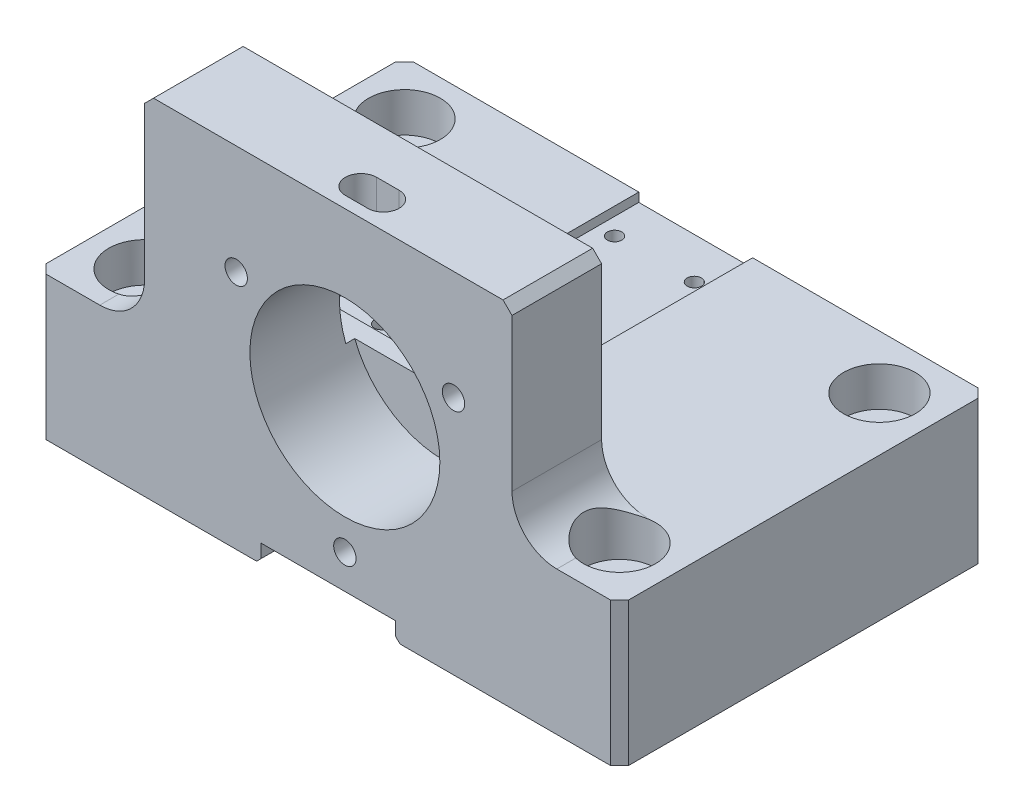
from build123d import *

# Parameters (mm, degrees)
SKETCH1_W                                           = 65
SKETCH1_H                                           = 41
BOSS_EXTRUDE1_DEPTH                                 = 16
SKETCH15_W                                          = 41
SKETCH15_H                                          = 10
BOSS_EXTRUDE4_DEPTH                                 = 23
SKETCH4_R                                           = 10.6
CUT_EXTRUDE3_DEPTH                                  = 11
M3_TAPPED_HOLE1_D                                   = 2.5
M3_TAPPED_HOLE1_DEPTH                               = 8.5
M3_TAPPED_HOLE1_TIP                                 = 0.751075774
CUT_EXTRUDE4_START                                  = -1
CUT_EXTRUDE4_DEPTH                                  = 1
SKETCH34_W                                          = 12.7
SKETCH34_H                                          = 2.6
CUT_EXTRUDE9_DEPTH                                  = 58.20576894
CUT_EXTRUDE7_DEPTH                                  = 1
M2_TAPPED_HOLE1_D                                   = 1.6
M2_TAPPED_HOLE1_DEPTH                               = 6
M2_TAPPED_HOLE1_TIP                                 = 0.480688495
CBORE_FOR_M4_HEX_SOCKET_HEAD_CAP_SCREW1_D           = 4.3
CBORE_FOR_M4_HEX_SOCKET_HEAD_CAP_SCREW1_CBORE_D     = 8
CBORE_FOR_M4_HEX_SOCKET_HEAD_CAP_SCREW1_CBORE_DEPTH = 4.4
FILLET1_R                                           = 5
CHAMFER4_SIZE                                       = 1
F_3_5_START                                         = 44
F_3_5_3_5_DIAMETER_SLOT1_DEPTH                      = 10
SKETCH33_W                                          = 15
SKETCH33_H                                          = 41
CUT_EXTRUDE8_DEPTH                                  = 2
CHAMFER5_SIZE                                       = 0.5


with BuildPart() as part:
    # Sketch1 → Boss-Extrude1 (new body)
    with BuildSketch(Plane(origin=(0, 15, 0), x_dir=(1, 0, 0), z_dir=(0, 1, 0))):
        with Locations((0, 20)):
            Rectangle(SKETCH1_W, SKETCH1_H)
    extrude(amount=BOSS_EXTRUDE1_DEPTH)

    # Sketch15 → Boss-Extrude4 (add)
    with BuildSketch(Plane(origin=(0, 31, 0), x_dir=(1, 0, 0), z_dir=(0, 1, 0))):
        with Locations((0, 4.5)):
            Rectangle(SKETCH15_W, SKETCH15_H)
    extrude(amount=BOSS_EXTRUDE4_DEPTH)

    # Sketch4 → Cut-Extrude3 (cut)
    with BuildSketch(Plane.XY.offset(0.5)):
        with Locations((1.85, 34.8)):
            Circle(SKETCH4_R)
    extrude(amount=-CUT_EXTRUDE3_DEPTH, mode=Mode.SUBTRACT)

    # M3 Tapped Hole1
    with Locations(Plane.XY.offset(0.5)):
        with Locations((13.974355653, 41.8), (1.85, 20.8), (-10.274355653, 41.8)):
            Hole(M3_TAPPED_HOLE1_D / 2, depth=M3_TAPPED_HOLE1_DEPTH)
            with Locations((0, 0, -(M3_TAPPED_HOLE1_DEPTH + M3_TAPPED_HOLE1_TIP / 2))):  # 118° drill point
                Cone(0, M3_TAPPED_HOLE1_D / 2, M3_TAPPED_HOLE1_TIP, mode=Mode.SUBTRACT)

    # Sketch16 → Cut-Extrude4 (cut)
    with BuildSketch(Plane(origin=(0, 31, 0), x_dir=(1, 0, 0), z_dir=(0, 1, 0)).offset(CUT_EXTRUDE4_START)):
        Polygon((-10.95, 12.5), (10.95, 12.5), (10.95, 16.3), (6.35, 16.3), (6.35, 37.9), (-6.35, 37.9), (-6.35, 16.3), (-10.95, 16.3), align=None)
    extrude(amount=CUT_EXTRUDE4_DEPTH, mode=Mode.SUBTRACT)

    # Sketch34 → Cut-Extrude9 (cut, through all)
    with BuildSketch(Plane(origin=(0, 30, 0), x_dir=(1, 0, 0), z_dir=(0, 1, 0))):
        with Locations((0, 39.2)):
            Rectangle(SKETCH34_W, SKETCH34_H)
    extrude(amount=CUT_EXTRUDE9_DEPTH, mode=Mode.SUBTRACT)

    # Sketch28 → Cut-Extrude7 (cut)
    with BuildSketch(Plane(origin=(0, 30, 0), x_dir=(1, 0, 0), z_dir=(0, 1, 0))):
        with BuildLine():
            Line((10.95, 12.5), (12.45, 12.5))
            ThreePointArc((12.45, 12.5), (13.510660172, 12.939339828), (13.95, 14))
            Line((13.95, 14), (13.95, 14.8))
            ThreePointArc((13.95, 14.8), (13.510660172, 15.860660172), (12.45, 16.3))
            Line((12.45, 16.3), (10.95, 16.3))
            Line((10.95, 16.3), (10.95, 12.5))
        make_face()
    cut_extrude7 = extrude(amount=CUT_EXTRUDE7_DEPTH, mode=Mode.SUBTRACT)

    # Mirror1: Cut-Extrude7 across plane
    add(cut_extrude7.mirror(Plane(origin=(0, 0, 0), x_dir=(0, 0, 1), z_dir=(1, 0, 0))), mode=Mode.SUBTRACT)

    # M2 Tapped Hole1
    with Locations(Plane(origin=(0, 30, 0), x_dir=(1, 0, 0), z_dir=(0, 1, 0))):
        with Locations((-4.45, 35.9), (4.45, 35.9), (8.95, 14.4), (-8.95, 14.4)):
            Hole(M2_TAPPED_HOLE1_D / 2, depth=M2_TAPPED_HOLE1_DEPTH)
            with Locations((0, 0, -(M2_TAPPED_HOLE1_DEPTH + M2_TAPPED_HOLE1_TIP / 2))):  # 118° drill point
                Cone(0, M2_TAPPED_HOLE1_D / 2, M2_TAPPED_HOLE1_TIP, mode=Mode.SUBTRACT)

    # CBORE for M4 Hex Socket Head Cap Screw1 (through all)
    with Locations(Plane(origin=(0, 31, 0), x_dir=(1, 0, 0), z_dir=(0, 1, 0))):
        with Locations((26.5, 34.5), (-26.5, 34.5), (-26.5, 5.5), (26.5, 5.5)):
            CounterBoreHole(CBORE_FOR_M4_HEX_SOCKET_HEAD_CAP_SCREW1_D / 2, CBORE_FOR_M4_HEX_SOCKET_HEAD_CAP_SCREW1_CBORE_D / 2, CBORE_FOR_M4_HEX_SOCKET_HEAD_CAP_SCREW1_CBORE_DEPTH)

    # Fillet1
    # the kernel refuses this fillet: 5 mm, written as the material it adds along each edge
    with BuildSketch(Plane(origin=(20.5, 31, 0.5), x_dir=(1, 0, 0), z_dir=(0, 0, -1))) as fillet1_piece_1_section:
        with BuildLine():
            CenterArc((FILLET1_R, -FILLET1_R), FILLET1_R, 90, 90)
            Line((0, -FILLET1_R), (0, 0))
            Line((0, 0), (FILLET1_R, 0))
        make_face()
    fillet1_piece_1 = extrude(amount=10, mode=Mode.PRIVATE)
    fillet1_piece_1 = fillet1_piece_1 - Plane(origin=(26.5, 31, -5.5), x_dir=(1, 0, 0), z_dir=(0, 1, 0)) * Cylinder(4, 41, mode=Mode.PRIVATE)
    add(fillet1_piece_1)
    with BuildSketch(Plane(origin=(-20.5, 31, -9.5), x_dir=(-1, 0, 0), z_dir=(0, 0, 1))) as fillet1_piece_2_section:
        with BuildLine():
            CenterArc((FILLET1_R, -FILLET1_R), FILLET1_R, 90, 90)
            Line((0, -FILLET1_R), (0, 0))
            Line((0, 0), (FILLET1_R, 0))
        make_face()
    fillet1_piece_2 = extrude(amount=10, mode=Mode.PRIVATE)
    fillet1_piece_2 = fillet1_piece_2 - Plane(origin=(-26.5, 31, -5.5), x_dir=(1, 0, 0), z_dir=(0, 1, 0)) * Cylinder(4, 41, mode=Mode.PRIVATE)
    add(fillet1_piece_2)

    # Chamfer4
    chamfer4_edges = [part.edges().sort_by_distance(p)[0] for p in [
        (-20.5, 54, -4.5),
        (20.5, 54, -4.5),
        (32.5, 23, 0.5),
        (-32.5, 23, 0.5),
        (32.5, 23, -40.5),
        (-32.5, 23, -40.5),
    ]]
    chamfer(chamfer4_edges, length=CHAMFER4_SIZE)

    # Ø3.5 (3.5) Diameter Slot1: read off the stored shape, not the designer's step
    # Ø3.5 (3.5) Diameter Slot1 outline → Ø3.5 (3.5) Diameter Slot1 (cut)
    with BuildSketch(Plane(origin=(0, 0, 0), x_dir=(1, 0, 0), z_dir=(0, 1, 0)).offset(F_3_5_START)):
        with BuildLine():
            Line((0.6, 0.8035), (3.1, 0.8035))
            ThreePointArc((3.1, 0.8035), (4.85, 2.5535), (3.1, 4.3035))
            Line((3.1, 4.3035), (0.6, 4.3035))
            ThreePointArc((0.6, 4.3035), (-1.15, 2.5535), (0.6, 0.8035))
        make_face()
    extrude(amount=F_3_5_3_5_DIAMETER_SLOT1_DEPTH, mode=Mode.SUBTRACT)

    # Sketch33 → Cut-Extrude8 (cut)
    with BuildSketch(Plane.XZ.offset(-15)):
        with Locations((0, -20)):
            Rectangle(SKETCH33_W, SKETCH33_H)
    extrude(amount=-CUT_EXTRUDE8_DEPTH, mode=Mode.SUBTRACT)

    # Chamfer5
    chamfer5_edges = [part.edges().sort_by_distance(p)[0] for p in [
        (7.5, 15, -20),
        (-7.5, 15, -20),
    ]]
    chamfer(chamfer5_edges, length=CHAMFER5_SIZE)


solid = part.part
